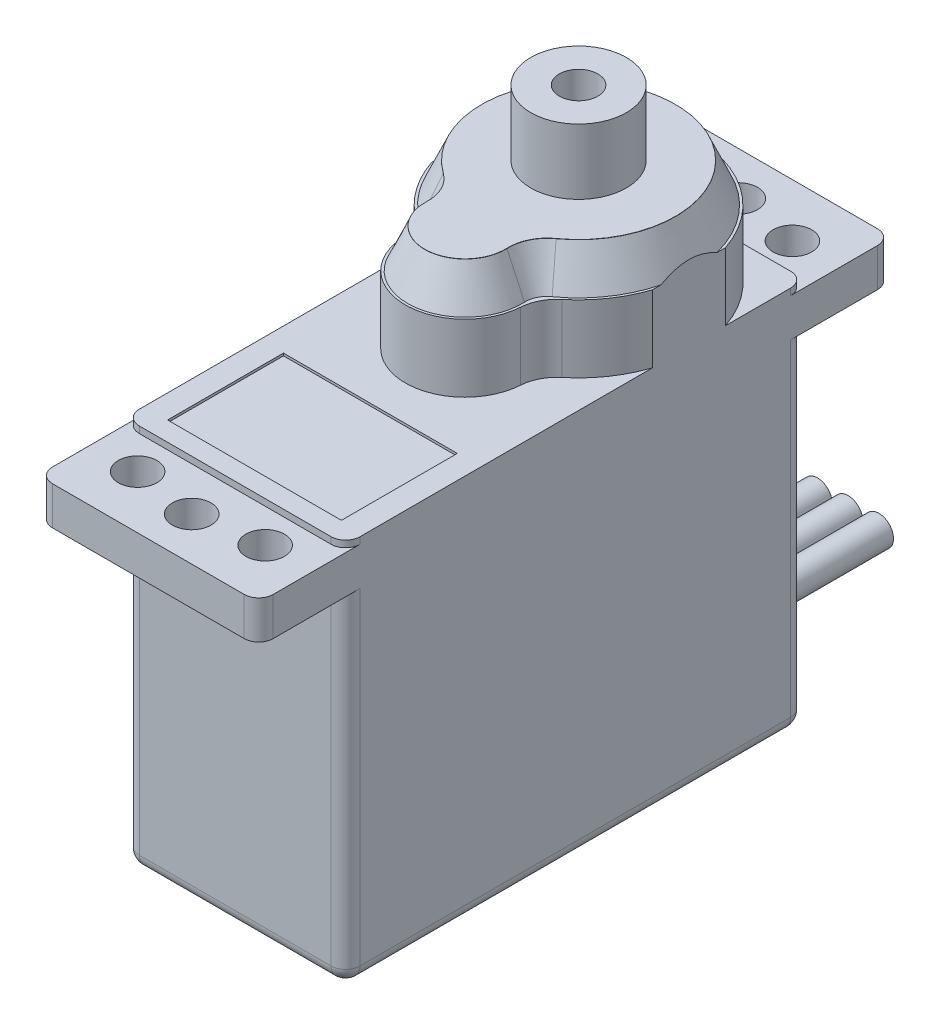
from build123d import *

# Parameters (mm, degrees)
EXTRUDE1_DEPTH      = 5.715
EXTRUDE1_DEPTH_BACK = 5.715
SKETCH1_W           = 23.7998
SKETCH1_H           = 20
BOSS_EXTRUDE7_DEPTH = 3.5
BOSS_EXTRUDE8_DEPTH = 2
SKETCH3_W           = 4.4958
SKETCH3_H           = 1.9812
EXTRUDE2_DEPTH      = 11.43
SKETCH4_R           = 0.999998
EXTRUDE3_DEPTH      = 27.22817507
SKETCH5_W           = 6.35
SKETCH5_H           = 4.445
BOSS_EXTRUDE1_DEPTH = 1.5875
SKETCH6_R           = 0.762
BOSS_EXTRUDE4_DEPTH = 6.35
SKETCH8_R           = 2.4765
BOSS_EXTRUDE6_DEPTH = 3.3782
SKETCH9_W           = 9
SKETCH9_H           = 6
CUT_EXTRUDE2_DEPTH  = 0.125
SKETCH11_R          = 1
CUT_EXTRUDE3_DEPTH  = 2
FILLET1_R           = 0.75
FILLET2_R           = 2
CHAMFER1_SIZE       = 0.875
CHAMFER1_SIZE_2     = 1.988588769


with BuildPart() as part:
    # Sketch1 → Extrude1 (new, two sides: drawn at the far end of the back side and taken through both)
    with BuildSketch(Plane(origin=(0, 0, 0), x_dir=(0, 0, -1), z_dir=(1, 0, 0)).offset(-EXTRUDE1_DEPTH_BACK)):
        Rectangle(SKETCH1_W, SKETCH1_H)
    extrude(amount=EXTRUDE1_DEPTH + EXTRUDE1_DEPTH_BACK)

    # Sketch2 → Boss-Extrude7 (add)
    with BuildSketch(Plane(origin=(0, 10, 0), x_dir=(-1, 0, 0), z_dir=(0, 1, 0))):
        with BuildLine():
            Line((5.715, -7.771334264), (5.715, -3.988865736))
            ThreePointArc((5.715, -3.988865736), (4.669043342, -2.080359705), (3.012827896, -0.668491793))
            ThreePointArc((3.012827896, -0.668491793), (0, 3.0861), (-3.012827896, -0.668491793))
            ThreePointArc((-3.012827896, -0.668491793), (-4.669043342, -2.080359705), (-5.715, -3.988865736))
            Line((-5.715, -3.988865736), (-5.715, -7.771334264))
            ThreePointArc((-5.715, -7.771334264), (0, -11.8999), (5.715, -7.771334264))
        make_face()
    extrude(amount=BOSS_EXTRUDE7_DEPTH)

    # Sketch10 → Boss-Extrude8 (add)
    with BuildSketch(Plane(origin=(0, 13.5, 0), x_dir=(1, 0, 0), z_dir=(0, 1, 0))):
        with BuildLine():
            ThreePointArc((-1.728861682, 1.167411879), (0, -2.0861), (1.728861682, 1.167411879))
            ThreePointArc((1.728861682, 1.167411879), (0, 10.8999), (-1.728861682, 1.167411879))
        make_face()
    extrude(amount=BOSS_EXTRUDE8_DEPTH)

    # Sketch3 → Extrude2 (add)
    with BuildSketch(Plane(origin=(5.715, 0, 0), x_dir=(0, 0, -1), z_dir=(1, 0, 0))):
        with Locations((-14.1478, 8.6674)):
            Rectangle(SKETCH3_W, SKETCH3_H)
        with Locations((14.1478, 8.6674)):
            Rectangle(SKETCH3_W, SKETCH3_H)
    extrude(amount=-EXTRUDE2_DEPTH)

    # Sketch4 → Extrude3 (cut, through all)
    with BuildSketch(Plane(origin=(0, 9.658, 0), x_dir=(1, 0, 0), z_dir=(0, 1, 0))):
        with Locations(Location((0, 14.15, 0), (0, 0, 270))):
            Circle(SKETCH4_R)
        with Locations(Location((0, -14.15, 0), (0, 0, 270))):
            Circle(SKETCH4_R)
        with Locations(Location((-3.302, 13.65, 0), (0, 0, 270))):
            Circle(SKETCH4_R)
        with Locations(Location((3.302, 13.65, 0), (0, 0, 270))):
            Circle(SKETCH4_R)
        with Locations(Location((3.302, -13.65, 0), (0, 0, 270))):
            Circle(SKETCH4_R)
        with Locations(Location((-3.302, -13.65, 0), (0, 0, 270))):
            Circle(SKETCH4_R)
    extrude(amount=-EXTRUDE3_DEPTH, mode=Mode.SUBTRACT)

    # Sketch5 → Boss-Extrude1 (add)
    with BuildSketch(Plane(origin=(0, 0, -11.8999), x_dir=(-1, 0, 0), z_dir=(0, 0, -1))):
        with Locations((0, -7.2695)):
            Rectangle(SKETCH5_W, SKETCH5_H)
    extrude(amount=BOSS_EXTRUDE1_DEPTH)

    # Sketch6 → Boss-Extrude4 (add)
    with BuildSketch(Plane(origin=(0, 0, -13.4874), x_dir=(-1, 0, 0), z_dir=(0, 0, -1))):
        with Locations(Location((0, -7.2695, 0), (0, 0, 180))):
            Circle(SKETCH6_R)
        with Locations(Location((-1.5875, -7.2695, 0), (0, 0, 180))):
            Circle(SKETCH6_R)
        with Locations(Location((1.5875, -7.2695, 0), (0, 0, 180))):
            Circle(SKETCH6_R)
    extrude(amount=BOSS_EXTRUDE4_DEPTH)

    # Sketch8 → Boss-Extrude6 (add)
    with BuildSketch(Plane(origin=(0, 15.5, 0), x_dir=(1, 0, 0), z_dir=(0, 1, 0))):
        with Locations(Location((0, 5.8801, 0), (0, 0, 270))):
            Circle(SKETCH8_R)
    extrude(amount=BOSS_EXTRUDE6_DEPTH)

    # Sketch9 → Cut-Extrude2 (cut)
    with BuildSketch(Plane(origin=(0, 10, 0), x_dir=(1, 0, 0), z_dir=(0, 1, 0))):
        with Locations((0, -7.8999)):
            Rectangle(SKETCH9_W, SKETCH9_H)
    extrude(amount=-CUT_EXTRUDE2_DEPTH, mode=Mode.SUBTRACT)

    # Sketch11 → Cut-Extrude3 (cut)
    with BuildSketch(Plane(origin=(0, 18.8782, 0), x_dir=(1, 0, 0), z_dir=(0, 1, 0))):
        with Locations(Location((0, 5.8801, 0), (0, 0, 270))):
            Circle(SKETCH11_R)
    extrude(amount=-CUT_EXTRUDE3_DEPTH, mode=Mode.SUBTRACT)

    # Fillet1
    # the kernel refuses this fillet: 0.75 mm, written as the material it takes off along each edge
    with BuildSketch(Plane(origin=(-4.965, -9.25, 11.1499), x_dir=(0, -1, 0), z_dir=(-1, 0, 0))) as fillet1_piece_1_section:
        Polygon((0, 0), (FILLET1_R, 0), (FILLET1_R, FILLET1_R), (0, FILLET1_R), align=None)
    fillet1_piece_1 = extrude(amount=FILLET1_R, mode=Mode.PRIVATE)
    fillet1_piece_1 = fillet1_piece_1 - Plane(origin=(-4.965, -9.25, 11.1499), x_dir=(0, 0.7071067811865475, -0.7071067811865475), z_dir=(-1, 0, 0)) * Sphere(FILLET1_R, mode=Mode.PRIVATE)
    add(fillet1_piece_1, mode=Mode.SUBTRACT)
    with BuildSketch(Plane(origin=(-4.965, -9.25, -11.1499), x_dir=(0, 0, -1), z_dir=(-1, 0, 0))) as fillet1_piece_2_section:
        Polygon((0, 0), (FILLET1_R, 0), (FILLET1_R, FILLET1_R), (0, FILLET1_R), align=None)
    fillet1_piece_2 = extrude(amount=FILLET1_R, mode=Mode.PRIVATE)
    fillet1_piece_2 = fillet1_piece_2 - Plane(origin=(-4.965, -9.25, -11.1499), x_dir=(0, 0.7071067811865475, 0.7071067811865475), z_dir=(-1, 0, 0)) * Sphere(FILLET1_R, mode=Mode.PRIVATE)
    add(fillet1_piece_2, mode=Mode.SUBTRACT)
    with BuildSketch(Plane(origin=(4.965, -9.25, 11.1499), x_dir=(0, -1, 0), z_dir=(1, 0, 0))) as fillet1_piece_3_section:
        Polygon((0, 0), (FILLET1_R, 0), (FILLET1_R, -FILLET1_R), (0, -FILLET1_R), align=None)
    fillet1_piece_3 = extrude(amount=FILLET1_R, mode=Mode.PRIVATE)
    fillet1_piece_3 = fillet1_piece_3 - Plane(origin=(4.965, -9.25, 11.1499), x_dir=(0, 0.7071067811865475, -0.7071067811865475), z_dir=(1, 0, 0)) * Sphere(FILLET1_R, mode=Mode.PRIVATE)
    add(fillet1_piece_3, mode=Mode.SUBTRACT)
    with BuildSketch(Plane(origin=(4.965, -9.25, -11.1499), x_dir=(0, 0, -1), z_dir=(1, 0, 0))) as fillet1_piece_4_section:
        Polygon((0, 0), (FILLET1_R, 0), (FILLET1_R, -FILLET1_R), (0, -FILLET1_R), align=None)
    fillet1_piece_4 = extrude(amount=FILLET1_R, mode=Mode.PRIVATE)
    fillet1_piece_4 = fillet1_piece_4 - Plane(origin=(4.965, -9.25, -11.1499), x_dir=(0, 0.7071067811865475, 0.7071067811865475), z_dir=(1, 0, 0)) * Sphere(FILLET1_R, mode=Mode.PRIVATE)
    add(fillet1_piece_4, mode=Mode.SUBTRACT)
    with BuildSketch(Plane(origin=(-5.715, -9.25, 11.8999), x_dir=(0, 0, -1), z_dir=(0, 1, 0)), Plane(origin=(-5.715, 7.6768, -11.8999), x_dir=(0, 0, 1), z_dir=(0, -1, 0))) as fillet1_piece_5:
        with BuildLine():
            CenterArc((FILLET1_R, -FILLET1_R), FILLET1_R, 90, 90)
            Line((0, -FILLET1_R), (0, 0))
            Line((0, 0), (FILLET1_R, 0))
        make_face()
    extrude(amount=16.9268, mode=Mode.SUBTRACT)
    with BuildSketch(Plane(origin=(-5.715, 11.533, -16.3957), x_dir=(0, 0, 1), z_dir=(0, -1, 0)), Plane(origin=(5.715, 11.533, 16.3957), x_dir=(0, 0, -1), z_dir=(0, -1, 0))) as fillet1_piece_6:
        with BuildLine():
            CenterArc((FILLET1_R, -FILLET1_R), FILLET1_R, 90, 90)
            Line((0, -FILLET1_R), (0, 0))
            Line((0, 0), (FILLET1_R, 0))
        make_face()
    extrude(amount=5.7312, mode=Mode.SUBTRACT)
    with BuildSketch(Plane(origin=(5.715, 11.533, -16.3957), x_dir=(0, 0, 1), z_dir=(0, -1, 0)), Plane(origin=(-5.715, 11.533, 16.3957), x_dir=(0, 0, -1), z_dir=(0, -1, 0))) as fillet1_piece_7:
        with BuildLine():
            CenterArc((FILLET1_R, FILLET1_R), FILLET1_R, 180, 90)
            Line((0, FILLET1_R), (0, 0))
            Line((0, 0), (FILLET1_R, 0))
        make_face()
    extrude(amount=5.7312, mode=Mode.SUBTRACT)
    with BuildSketch(Plane(origin=(-5.715, 11.875, -11.8999), x_dir=(0, 0, 1), z_dir=(0, -1, 0)), Plane(origin=(5.715, 9.658, 11.8999), x_dir=(-1, 0, 0), z_dir=(0, 1, 0))) as fillet1_piece_8:
        with BuildLine():
            CenterArc((FILLET1_R, -FILLET1_R), FILLET1_R, 90, 90)
            Line((0, -FILLET1_R), (0, 0))
            Line((0, 0), (FILLET1_R, 0))
        make_face()
    extrude(amount=2.217, mode=Mode.SUBTRACT)
    with BuildSketch(Plane(origin=(5.715, 11.875, -11.8999), x_dir=(0, 0, 1), z_dir=(0, -1, 0)), Plane(origin=(-5.715, 9.658, 11.8999), x_dir=(1, 0, 0), z_dir=(0, 1, 0))) as fillet1_piece_9:
        with BuildLine():
            CenterArc((FILLET1_R, FILLET1_R), FILLET1_R, 180, 90)
            Line((0, FILLET1_R), (0, 0))
            Line((0, 0), (FILLET1_R, 0))
        make_face()
    extrude(amount=2.217, mode=Mode.SUBTRACT)
    with BuildSketch(Plane(origin=(-4.965, -10, 11.8999), x_dir=(0, 0, -1), z_dir=(1, 0, 0))) as fillet1_piece_10:
        with BuildLine():
            CenterArc((FILLET1_R, FILLET1_R), FILLET1_R, 180, 90)
            Line((0, FILLET1_R), (0, 0))
            Line((0, 0), (FILLET1_R, 0))
        make_face()
    extrude(amount=9.93, mode=Mode.SUBTRACT)
    with BuildSketch(Plane(origin=(4.965, -10, -11.8999), x_dir=(0, 1, 0), z_dir=(-1, 0, 0))) as fillet1_piece_11_section:
        with BuildLine():
            CenterArc((FILLET1_R, -FILLET1_R), FILLET1_R, 90, 90)
            Line((0, -FILLET1_R), (0, 0))
            Line((0, 0), (FILLET1_R, 0))
        make_face()
    fillet1_piece_11 = extrude(amount=9.93, mode=Mode.PRIVATE)
    fillet1_piece_11 = split(fillet1_piece_11, bisect_by=Plane(origin=(4.965, -9.492, -11.8999), z_dir=(0, 1, 0)), keep=Keep.TOP, mode=Mode.PRIVATE)
    fillet1_piece_11 = split(fillet1_piece_11, bisect_by=Plane(origin=(3.175, -10, -11.8999), z_dir=(1, 0, 0)), keep=Keep.TOP, mode=Mode.PRIVATE)
    add(fillet1_piece_11, mode=Mode.SUBTRACT)
    with BuildSketch(Plane(origin=(4.965, -10, -11.8999), x_dir=(0, 1, 0), z_dir=(-1, 0, 0))) as fillet1_piece_12_section:
        with BuildLine():
            CenterArc((FILLET1_R, -FILLET1_R), FILLET1_R, 90, 90)
            Line((0, -FILLET1_R), (0, 0))
            Line((0, 0), (FILLET1_R, 0))
        make_face()
    fillet1_piece_12 = extrude(amount=9.93, mode=Mode.PRIVATE)
    fillet1_piece_12 = split(fillet1_piece_12, bisect_by=Plane(origin=(4.965, -9.492, -11.8999), z_dir=(0, -1, 0)), keep=Keep.TOP, mode=Mode.PRIVATE)
    fillet1_piece_12 = split(fillet1_piece_12, bisect_by=Plane(origin=(3.175, -10, -11.8999), z_dir=(1, 0, 0)), keep=Keep.TOP, mode=Mode.PRIVATE)
    add(fillet1_piece_12, mode=Mode.SUBTRACT)
    with BuildSketch(Plane(origin=(4.965, -10, -11.8999), x_dir=(0, 1, 0), z_dir=(-1, 0, 0))) as fillet1_piece_13_section:
        with BuildLine():
            CenterArc((FILLET1_R, -FILLET1_R), FILLET1_R, 90, 90)
            Line((0, -FILLET1_R), (0, 0))
            Line((0, 0), (FILLET1_R, 0))
        make_face()
    fillet1_piece_13 = extrude(amount=9.93, mode=Mode.PRIVATE)
    fillet1_piece_13 = split(fillet1_piece_13, bisect_by=Plane(origin=(4.965, -9.492, -11.8999), z_dir=(0, -1, 0)), keep=Keep.TOP, mode=Mode.PRIVATE)
    fillet1_piece_13 = split(fillet1_piece_13, bisect_by=Plane(origin=(-3.175, -10, -11.8999), z_dir=(1, 0, 0)), keep=Keep.TOP, mode=Mode.PRIVATE)
    fillet1_piece_13 = split(fillet1_piece_13, bisect_by=Plane(origin=(3.175, -10, -11.8999), z_dir=(-1, 0, 0)), keep=Keep.TOP, mode=Mode.PRIVATE)
    add(fillet1_piece_13, mode=Mode.SUBTRACT)
    with BuildSketch(Plane(origin=(4.965, -10, -11.8999), x_dir=(0, 1, 0), z_dir=(-1, 0, 0))) as fillet1_piece_14_section:
        with BuildLine():
            CenterArc((FILLET1_R, -FILLET1_R), FILLET1_R, 90, 90)
            Line((0, -FILLET1_R), (0, 0))
            Line((0, 0), (FILLET1_R, 0))
        make_face()
    fillet1_piece_14 = extrude(amount=9.93, mode=Mode.PRIVATE)
    fillet1_piece_14 = split(fillet1_piece_14, bisect_by=Plane(origin=(4.965, -9.492, -11.8999), z_dir=(0, 1, 0)), keep=Keep.TOP, mode=Mode.PRIVATE)
    fillet1_piece_14 = split(fillet1_piece_14, bisect_by=Plane(origin=(-3.175, -10, -11.8999), z_dir=(-1, 0, 0)), keep=Keep.TOP, mode=Mode.PRIVATE)
    add(fillet1_piece_14, mode=Mode.SUBTRACT)
    with BuildSketch(Plane(origin=(4.965, -10, -11.8999), x_dir=(0, 1, 0), z_dir=(-1, 0, 0))) as fillet1_piece_15_section:
        with BuildLine():
            CenterArc((FILLET1_R, -FILLET1_R), FILLET1_R, 90, 90)
            Line((0, -FILLET1_R), (0, 0))
            Line((0, 0), (FILLET1_R, 0))
        make_face()
    fillet1_piece_15 = extrude(amount=9.93, mode=Mode.PRIVATE)
    fillet1_piece_15 = split(fillet1_piece_15, bisect_by=Plane(origin=(4.965, -9.492, -11.8999), z_dir=(0, -1, 0)), keep=Keep.TOP, mode=Mode.PRIVATE)
    fillet1_piece_15 = split(fillet1_piece_15, bisect_by=Plane(origin=(-3.175, -10, -11.8999), z_dir=(-1, 0, 0)), keep=Keep.TOP, mode=Mode.PRIVATE)
    add(fillet1_piece_15, mode=Mode.SUBTRACT)
    with BuildSketch(Plane(origin=(-5.715, -10, -11.1499), x_dir=(0, 1, 0), z_dir=(0, 0, 1))) as fillet1_piece_16:
        with BuildLine():
            CenterArc((FILLET1_R, -FILLET1_R), FILLET1_R, 90, 90)
            Line((0, -FILLET1_R), (0, 0))
            Line((0, 0), (FILLET1_R, 0))
        make_face()
    extrude(amount=22.2998, mode=Mode.SUBTRACT)
    with BuildSketch(Plane(origin=(5.715, -9.25, 11.8999), x_dir=(0, 0, -1), z_dir=(0, 1, 0)), Plane(origin=(5.715, 7.6768, -11.8999), x_dir=(0, 0, 1), z_dir=(0, -1, 0))) as fillet1_piece_17:
        with BuildLine():
            CenterArc((FILLET1_R, FILLET1_R), FILLET1_R, 180, 90)
            Line((0, FILLET1_R), (0, 0))
            Line((0, 0), (FILLET1_R, 0))
        make_face()
    extrude(amount=16.9268, mode=Mode.SUBTRACT)
    with BuildSketch(Plane(origin=(5.715, -10, -11.1499), x_dir=(0, 1, 0), z_dir=(0, 0, 1))) as fillet1_piece_18:
        with BuildLine():
            CenterArc((FILLET1_R, FILLET1_R), FILLET1_R, 180, 90)
            Line((0, FILLET1_R), (0, 0))
            Line((0, 0), (FILLET1_R, 0))
        make_face()
    extrude(amount=22.2998, mode=Mode.SUBTRACT)

    # Fillet2
    fillet2_edges = [part.edges().sort_by_distance(p)[0] for p in [
        (3.012827896, 11.75, -0.668491793),
        (-3.012827896, 11.75, -0.668491793),
        (-1.728861682, 14.5, -1.167411879),
        (1.728861682, 14.5, -1.167411879),
    ]]
    fillet(fillet2_edges, radius=FILLET2_R)

    # Chamfer1
    # the kernel refuses this chamfer: 1.988588769, 0.875 mm, written as the material it adds along each edge
    with BuildSketch(Plane(origin=(0, 13.5, -5.8801), x_dir=(0.5815806576828839, 0, 0.81348874522586), z_dir=(-0.81348874522586, 0, 0.5815806576828839))) as chamfer1_piece_1_section:
        Polygon((5.0198 + CHAMFER1_SIZE, 0), (5.0198, CHAMFER1_SIZE_2), (5.0198, 0), align=None)
    chamfer1_piece_1 = revolve(axis=Axis((0, 13.5, -5.8801), (0, 1, 0)), revolution_arc=288.87641071, mode=Mode.PRIVATE)
    chamfer1_piece_1 = split(chamfer1_piece_1, bisect_by=Plane(origin=(-5.715, 13.5, -5.8801), z_dir=(1, 0, 0)), keep=Keep.TOP, mode=Mode.PRIVATE)
    chamfer1_piece_1 = split(chamfer1_piece_1, bisect_by=Plane(origin=(5.715, 13.5, -5.8801), z_dir=(-1, 0, 0)), keep=Keep.TOP, mode=Mode.PRIVATE)
    add(chamfer1_piece_1)
    with BuildSketch(Plane(origin=(0, 13.5, 0), x_dir=(-0.9991385185879694, 0, -0.04149964667123892), z_dir=(0.04149964667123892, 0, -0.9991385185879694))) as chamfer1_piece_2:
        Polygon((2.0861 + CHAMFER1_SIZE, 0), (2.0861, CHAMFER1_SIZE_2), (2.0861, 0), align=None)
    revolve(axis=Axis((0, 13.5, 0), (0, 1, 0)), revolution_arc=184.756875276)
    with BuildSketch(Plane(origin=(-4.082579536, 13.5, -0.169571815), x_dir=(0.99913851602915, 0, 0.041499708276900374), z_dir=(-0.041499708276900374, 0, 0.99913851602915))) as chamfer1_piece_3:
        Polygon((1.99999964 - CHAMFER1_SIZE, 0), (1.99999964 - CHAMFER1_SIZE_2 * 7.6806587158e-09, CHAMFER1_SIZE_2), (1.99999964, 0), align=None)
    revolve(axis=Axis((-4.082579536, 13.5, -0.169571815), (0, 1, 0)), revolution_arc=56.816653232)
    with BuildSketch(Plane(origin=(4.082579536, 13.5, -0.169571815), x_dir=(-0.99913851602915, 0, 0.041499708276901796), z_dir=(0.041499708276901796, 0, 0.99913851602915))) as chamfer1_piece_4:
        Polygon((1.99999964 - CHAMFER1_SIZE, 0), (1.99999964 - CHAMFER1_SIZE_2 * 7.6806587158e-09, -CHAMFER1_SIZE_2), (1.99999964, 0), align=None)
    revolve(axis=Axis((4.082579536, 13.5, -0.169571815), (0, -1, 0)), revolution_arc=56.816653232)


solid = part.part
